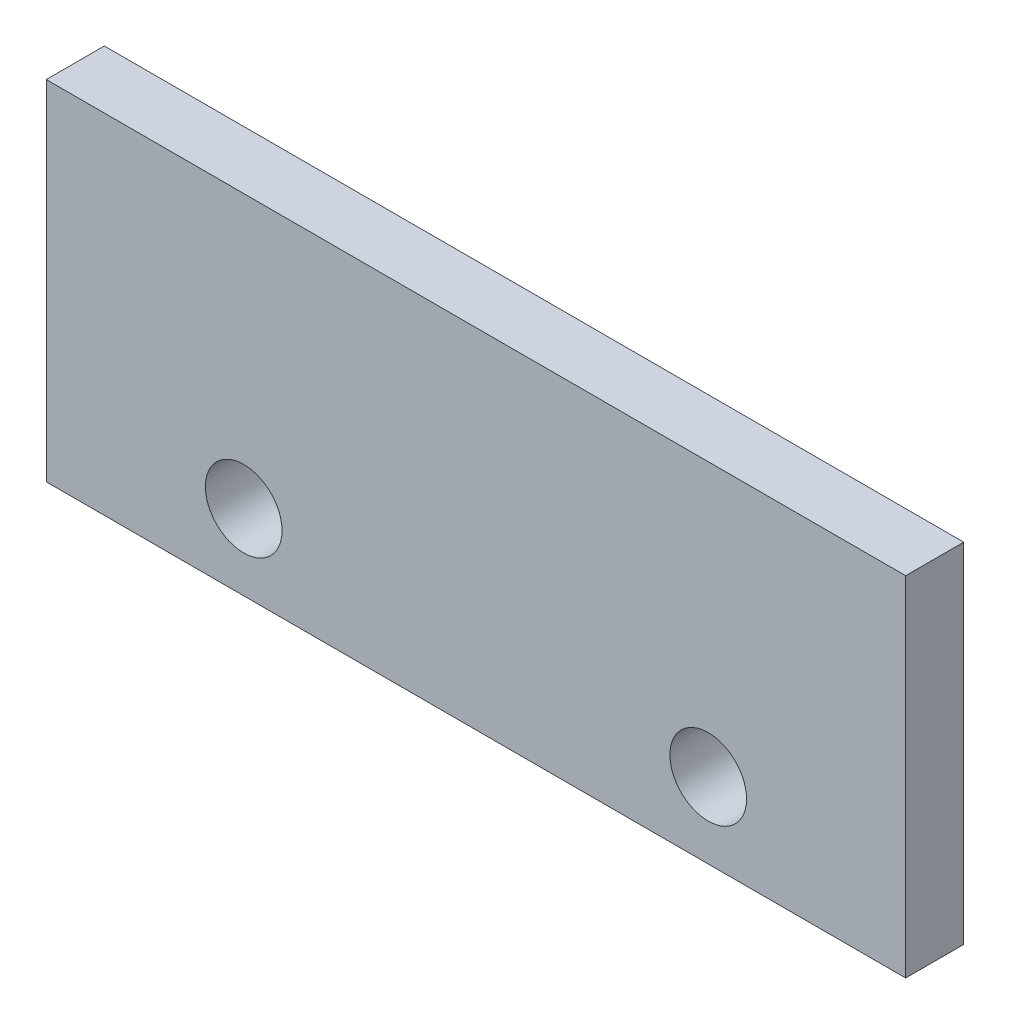
from build123d import *

# Parameters (mm, degrees)
SKETCH1_W            = 74
SKETCH1_H            = 30
BOSS_EXTRUDE1_DEPTH  = 5
M6_CLEARANCE_HOLE1_D = 6.6


with BuildPart() as part:
    # Sketch1 → Boss-Extrude1 (new body)
    with BuildSketch(Plane.XY):
        with Locations((37, 15)):
            Rectangle(SKETCH1_W, SKETCH1_H)
    extrude(amount=BOSS_EXTRUDE1_DEPTH)

    # M6 Clearance Hole1 (through all)
    with Locations(Plane.XY.offset(5)):
        with Locations((17, 6.5), (57, 6.5)):
            Hole(M6_CLEARANCE_HOLE1_D / 2)


solid = part.part
